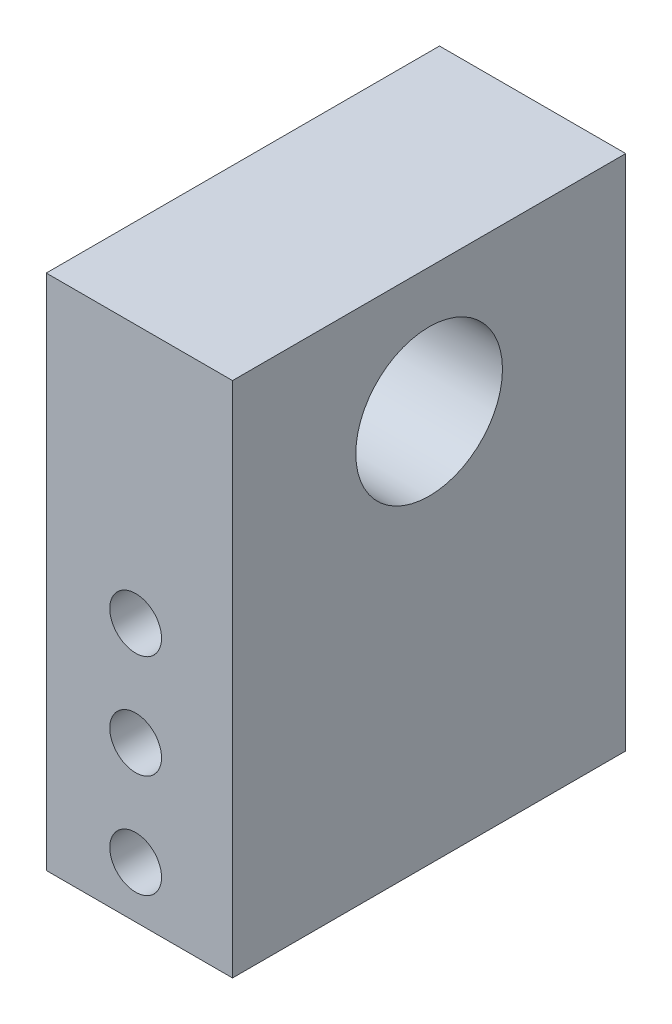
from build123d import *

# Parameters (mm, degrees)
SKETCH1_W           = 45.72
SKETCH1_H           = 76.2
BOSS_EXTRUDE1_DEPTH = 48.26
SKETCH2_R           = 6.35
CUT_EXTRUDE1_DEPTH  = 132.197823153
SKETCH3_W           = 45.72
SKETCH3_H           = 96.52
BOSS_EXTRUDE2_DEPTH = 50.8
SKETCH4_R           = 17.999964
CUT_EXTRUDE2_DEPTH  = 40.64
SKETCH5_R           = 2.999994
CUT_EXTRUDE3_DEPTH  = 142.808452498


with BuildPart() as part:
    # Sketch1 → Boss-Extrude1 (new, symmetric)
    with BuildSketch(Plane.XY):
        with Locations((22.86, 38.1)):
            Rectangle(SKETCH1_W, SKETCH1_H)
    extrude(amount=BOSS_EXTRUDE1_DEPTH, both=True)

    # Sketch2 → Cut-Extrude1 (cut, through all)
    with BuildSketch(Plane.XY.offset(48.26)):
        with Locations((21.944063491, 12.7)):
            Circle(SKETCH2_R)
        with Locations((21.944063491, 38.1)):
            Circle(SKETCH2_R)
        with Locations((21.944063491, 63.5)):
            Circle(SKETCH2_R)
    extrude(amount=-CUT_EXTRUDE1_DEPTH, mode=Mode.SUBTRACT)

    # Sketch3 → Boss-Extrude2 (add)
    with BuildSketch(Plane(origin=(0, 76.2, 0), x_dir=(1, 0, 0), z_dir=(0, 1, 0))):
        with Locations((22.86, 0)):
            Rectangle(SKETCH3_W, SKETCH3_H)
    extrude(amount=BOSS_EXTRUDE2_DEPTH)

    # Sketch4 → Cut-Extrude2 (cut)
    with BuildSketch(Plane(origin=(45.72, 0, 0), x_dir=(0, 0, -1), z_dir=(1, 0, 0))):
        with Locations((0, 96.300036)):
            Circle(SKETCH4_R)
    extrude(amount=-CUT_EXTRUDE2_DEPTH, mode=Mode.SUBTRACT)

    # Sketch5 → Cut-Extrude3 (cut, through all)
    with BuildSketch(Plane(origin=(5.08, 0, 0), x_dir=(0, 0, -1), z_dir=(1, 0, 0))):
        with Locations((0, 96.300036)):
            Circle(SKETCH5_R)
    extrude(amount=-CUT_EXTRUDE3_DEPTH, mode=Mode.SUBTRACT)


solid = part.part
